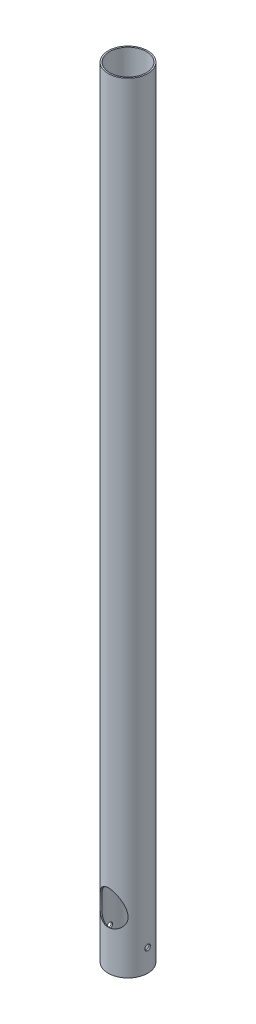
from build123d import *

# Parameters (mm, degrees)
EXTRUDE_1_OUTLINE_R      = 70.5
EXTRUDE_1_OUTLINE_R_2    = 65.5
EXTRUDE_1_DEPTH          = 2780
CUT_EXTRUDE_3_DEPTH      = 2782.787285182
CUT_EXTRUDE_3_DEPTH_BACK = 2782.787285182
SKETCH_6_R               = 10
SKETCH_7_R               = 50
CUT_EXTRUDE_4_DEPTH      = 200
SKETCH_10_R              = 55
CUT_EXTRUDE_5_DEPTH      = 2782.787285287
CUT_EXTRUDE_8_REACH      = 2332.007
SKETCH_13_R              = 52.5


# Read off the part's stored shape, not the designer's step: Вытянуть-Тонкостенный1
with BuildPart() as part:
    # Вытянуть-Тонкостенный1 outline → Вытянуть-Тонкостенный1 (new body)
    with BuildSketch(Plane(origin=(0, 0, 0), x_dir=(1, 0, 0), z_dir=(0, 1, 0))):
        Circle(EXTRUDE_1_OUTLINE_R)
        Circle(EXTRUDE_1_OUTLINE_R_2, mode=Mode.SUBTRACT)
    extrude(amount=EXTRUDE_1_DEPTH)

    # Эскиз6 → Вырез-Вытянуть3 (cut, two sides: drawn at the far end of the back side and taken through both)
    with BuildSketch(Plane(origin=(0, 0, 0), x_dir=(0, 0, -1), z_dir=(1, 0, 0)).offset(-CUT_EXTRUDE_3_DEPTH_BACK)):
        with Locations((0, 80)):
            Circle(SKETCH_6_R)
    extrude(amount=CUT_EXTRUDE_3_DEPTH + CUT_EXTRUDE_3_DEPTH_BACK, mode=Mode.SUBTRACT)

    # Эскиз7 → Вырез-Вытянуть4 (cut)
    with BuildSketch(Plane(origin=(0, 176.689515805, 252.338779809), x_dir=(1, 0, 0), z_dir=(0, -0.5735764363510416, -0.8191520442889949))):
        with Locations(Location((0, -126.118813858, 0), (0, 0, 90))):
            Circle(SKETCH_7_R)
    extrude(amount=CUT_EXTRUDE_4_DEPTH, mode=Mode.SUBTRACT)

    # Эскиз10 → Вырез-Вытянуть5 (cut, through all)
    with BuildSketch(Plane.XY):
        with Locations(Location((0, 2630, 0), (0, 0, 90))):
            Circle(SKETCH_10_R)
    extrude(amount=-CUT_EXTRUDE_5_DEPTH, mode=Mode.SUBTRACT)

    # Эскиз13 → Вырез-Вытянуть8 (cut, up to next)
    with BuildSketch(Plane(origin=(0, 750.265952156, 1071.490824098), x_dir=(1, 0, 0), z_dir=(0, -0.5735764363510416, -0.8191520442889949)), mode=Mode.PRIVATE) as cut_extrude_8_sk1:
        with Locations((0, -2185)):
            Circle(SKETCH_13_R)
    cut_extrude_8_tool1 = extrude(cut_extrude_8_sk1.sketch, amount=-CUT_EXTRUDE_8_REACH, mode=Mode.PRIVATE) & part.part
    add(cut_extrude_8_tool1.solids().sort_by_distance((0, 2540.113169, -181.773689))[0], mode=Mode.SUBTRACT)


solid = part.part
